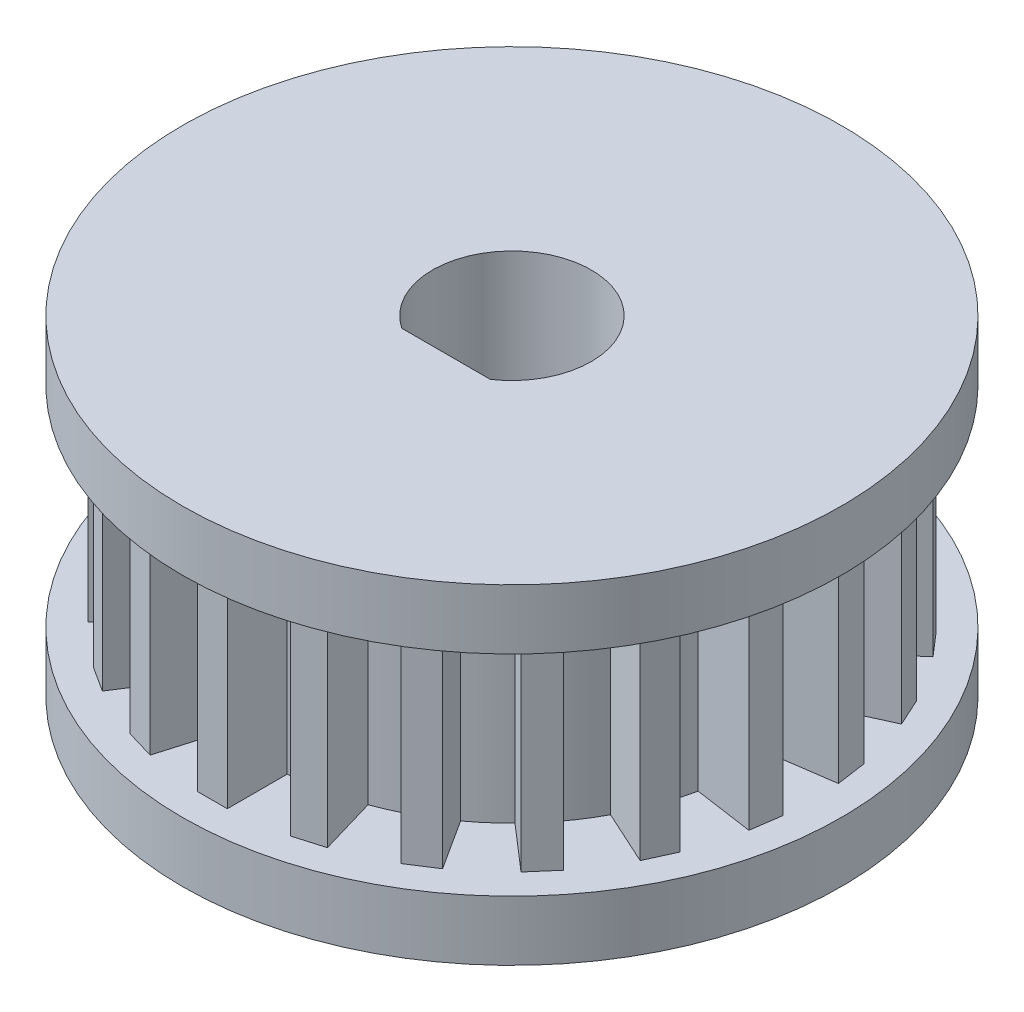
from build123d import *

# Parameters (mm, degrees)
BOSS_EXTRUDE1_DEPTH = 11
BOSS_EXTRUDE2_DEPTH = 2
BOSS_EXTRUDE3_START = 9
BOSS_EXTRUDE3_DEPTH = 2


# Read off the part's stored shape, not the designer's step: Boss-Extrude1
with BuildPart() as part:
    # Boss-Extrude1 outline → Boss-Extrude1 (new body)
    with BuildSketch(Plane(origin=(0, 0, 0), x_dir=(1, 0, 0), z_dir=(0, 1, 0))):
        with BuildLine():
            Line((-0.5, -8), (-0.5, -10))
            Line((-0.5, -10), (0.5, -10))
            Line((0.5, -10), (0.5, -8))
            ThreePointArc((0.5, -8), (1.140740208, -7.934022421), (1.774113968, -7.816810067))
            Line((1.774113968, -7.816810067), (2.337579082, -9.735796015))
            Line((2.337579082, -9.735796015), (3.297072055, -9.454063458))
            Line((3.297072055, -9.454063458), (2.733606942, -7.53507751))
            ThreePointArc((2.733606942, -7.53507751), (3.329804637, -7.29125511), (3.904499773, -7.000348671))
            Line((3.904499773, -7.000348671), (4.985781408, -8.682855737))
            Line((4.985781408, -8.682855737), (5.827034941, -8.14221492))
            Line((5.827034941, -8.14221492), (4.745753306, -6.459707854))
            ThreePointArc((4.745753306, -6.459707854), (5.249108098, -6.057793673), (5.718566228, -5.616760659))
            Line((5.718566228, -5.616760659), (7.230065377, -6.926482127))
            Line((7.230065377, -6.926482127), (7.884926111, -6.170732552))
            Line((7.884926111, -6.170732552), (6.373426962, -4.861011084))
            ThreePointArc((6.373426962, -4.861011084), (6.743160038, -4.333565819), (7.069348456, -3.778136102))
            Line((7.069348456, -3.778136102), (8.888612447, -4.608966128))
            Line((8.888612447, -4.608966128), (9.30402746, -3.699334132))
            Line((9.30402746, -3.699334132), (7.484763469, -2.868504106))
            ThreePointArc((7.484763469, -2.868504106), (7.690921254, -2.258258235), (7.847414116, -1.633429427))
            Line((7.847414116, -1.633429427), (9.827057, -1.918059104))
            Line((9.827057, -1.918059104), (9.969371838, -0.928237662))
            Line((9.969371838, -0.928237662), (7.989728954, -0.643607985))
            ThreePointArc((7.989728954, -0.643607985), (8.015609771, 0), (7.989728954, 0.643607985))
            Line((7.989728954, 0.643607985), (9.969371838, 0.928237662))
            Line((9.969371838, 0.928237662), (9.827057, 1.918059104))
            Line((9.827057, 1.918059104), (7.847414116, 1.633429427))
            ThreePointArc((7.847414116, 1.633429427), (7.690921254, 2.258258235), (7.484763469, 2.868504106))
            Line((7.484763469, 2.868504106), (9.30402746, 3.699334132))
            Line((9.30402746, 3.699334132), (8.888612447, 4.608966128))
            Line((8.888612447, 4.608966128), (7.069348456, 3.778136102))
            ThreePointArc((7.069348456, 3.778136102), (6.743160038, 4.333565819), (6.373426962, 4.861011084))
            Line((6.373426962, 4.861011084), (7.884926111, 6.170732552))
            Line((7.884926111, 6.170732552), (7.230065377, 6.926482127))
            Line((7.230065377, 6.926482127), (5.718566228, 5.616760659))
            ThreePointArc((5.718566228, 5.616760659), (5.249108098, 6.057793673), (4.745753306, 6.459707854))
            Line((4.745753306, 6.459707854), (5.827034941, 8.14221492))
            Line((5.827034941, 8.14221492), (4.985781408, 8.682855737))
            Line((4.985781408, 8.682855737), (3.904499773, 7.000348671))
            ThreePointArc((3.904499773, 7.000348671), (3.329804637, 7.29125511), (2.733606942, 7.53507751))
            Line((2.733606942, 7.53507751), (3.297072055, 9.454063458))
            Line((3.297072055, 9.454063458), (2.337579082, 9.735796015))
            Line((2.337579082, 9.735796015), (1.774113968, 7.816810067))
            ThreePointArc((1.774113968, 7.816810067), (1.140740208, 7.934022421), (0.5, 8))
            Line((0.5, 8), (0.5, 10))
            Line((0.5, 10), (-0.5, 10))
            Line((-0.5, 10), (-0.5, 8))
            ThreePointArc((-0.5, 8), (-1.140740208, 7.934022421), (-1.774113968, 7.816810067))
            Line((-1.774113968, 7.816810067), (-2.337579082, 9.735796015))
            Line((-2.337579082, 9.735796015), (-3.297072055, 9.454063458))
            Line((-3.297072055, 9.454063458), (-2.733606942, 7.53507751))
            ThreePointArc((-2.733606942, 7.53507751), (-3.329804637, 7.29125511), (-3.904499773, 7.000348671))
            Line((-3.904499773, 7.000348671), (-4.985781408, 8.682855737))
            Line((-4.985781408, 8.682855737), (-5.827034941, 8.14221492))
            Line((-5.827034941, 8.14221492), (-4.745753306, 6.459707854))
            ThreePointArc((-4.745753306, 6.459707854), (-5.249108098, 6.057793673), (-5.718566228, 5.616760659))
            Line((-5.718566228, 5.616760659), (-7.230065377, 6.926482127))
            Line((-7.230065377, 6.926482127), (-7.884926111, 6.170732552))
            Line((-7.884926111, 6.170732552), (-6.373426962, 4.861011084))
            ThreePointArc((-6.373426962, 4.861011084), (-6.743160038, 4.333565819), (-7.069348456, 3.778136102))
            Line((-7.069348456, 3.778136102), (-8.888612447, 4.608966128))
            Line((-8.888612447, 4.608966128), (-9.30402746, 3.699334132))
            Line((-9.30402746, 3.699334132), (-7.484763469, 2.868504106))
            ThreePointArc((-7.484763469, 2.868504106), (-7.690921254, 2.258258235), (-7.847414116, 1.633429427))
            Line((-7.847414116, 1.633429427), (-9.827057, 1.918059104))
            Line((-9.827057, 1.918059104), (-9.969371838, 0.928237662))
            Line((-9.969371838, 0.928237662), (-7.989728954, 0.643607985))
            ThreePointArc((-7.989728954, 0.643607985), (-8.015609771, 0), (-7.989728954, -0.643607985))
            Line((-7.989728954, -0.643607985), (-9.969371838, -0.928237662))
            Line((-9.969371838, -0.928237662), (-9.827057, -1.918059104))
            Line((-9.827057, -1.918059104), (-7.847414116, -1.633429427))
            ThreePointArc((-7.847414116, -1.633429427), (-7.690921254, -2.258258235), (-7.484763469, -2.868504106))
            Line((-7.484763469, -2.868504106), (-9.30402746, -3.699334132))
            Line((-9.30402746, -3.699334132), (-8.888612447, -4.608966128))
            Line((-8.888612447, -4.608966128), (-7.069348456, -3.778136102))
            ThreePointArc((-7.069348456, -3.778136102), (-6.743160038, -4.333565819), (-6.373426962, -4.861011084))
            Line((-6.373426962, -4.861011084), (-7.884926111, -6.170732552))
            Line((-7.884926111, -6.170732552), (-7.230065377, -6.926482127))
            Line((-7.230065377, -6.926482127), (-5.718566228, -5.616760659))
            ThreePointArc((-5.718566228, -5.616760659), (-5.249108098, -6.057793673), (-4.745753306, -6.459707854))
            Line((-4.745753306, -6.459707854), (-5.827034941, -8.14221492))
            Line((-5.827034941, -8.14221492), (-4.985781408, -8.682855737))
            Line((-4.985781408, -8.682855737), (-3.904499773, -7.000348671))
            ThreePointArc((-3.904499773, -7.000348671), (-3.329804637, -7.29125511), (-2.733606942, -7.53507751))
            Line((-2.733606942, -7.53507751), (-3.297072055, -9.454063458))
            Line((-3.297072055, -9.454063458), (-2.337579082, -9.735796015))
            Line((-2.337579082, -9.735796015), (-1.774113968, -7.816810067))
            ThreePointArc((-1.774113968, -7.816810067), (-1.140740208, -7.934022421), (-0.5, -8))
        make_face()
        with BuildLine():
            Line((1.47732867, -2.2), (-1.47732867, -2.2))
            ThreePointArc((-1.47732867, -2.2), (0, 2.65), (1.47732867, -2.2))
        make_face(mode=Mode.SUBTRACT)
    extrude(amount=BOSS_EXTRUDE1_DEPTH)

    # Sketch1<6> → Boss-Extrude2 (add)
    with BuildSketch(Plane(origin=(0, 0, 0), x_dir=(1, 0, 0), z_dir=(0, 1, 0))):
        with BuildLine():
            Line((0, 10), (0, 11))
            ThreePointArc((0, 11), (-11, 0), (0, -11))
            Line((0, -11), (0, -10))
            Line((0, -10), (-0.5, -10))
            Line((-0.5, -10), (-0.5, -8))
            ThreePointArc((-0.5, -8), (-1.140740208, -7.934022421), (-1.774113968, -7.816810067))
            Line((-1.774113968, -7.816810067), (-2.337579082, -9.735796015))
            Line((-2.337579082, -9.735796015), (-3.297072055, -9.454063458))
            Line((-3.297072055, -9.454063458), (-2.733606942, -7.53507751))
            ThreePointArc((-2.733606942, -7.53507751), (-3.329804637, -7.29125511), (-3.904499773, -7.000348671))
            Line((-3.904499773, -7.000348671), (-4.985781408, -8.682855737))
            Line((-4.985781408, -8.682855737), (-5.827034941, -8.14221492))
            Line((-5.827034941, -8.14221492), (-4.745753306, -6.459707854))
            ThreePointArc((-4.745753306, -6.459707854), (-5.249108098, -6.057793673), (-5.718566228, -5.616760659))
            Line((-5.718566228, -5.616760659), (-7.230065377, -6.926482127))
            Line((-7.230065377, -6.926482127), (-7.884926111, -6.170732552))
            Line((-7.884926111, -6.170732552), (-6.373426962, -4.861011084))
            ThreePointArc((-6.373426962, -4.861011084), (-6.743160038, -4.333565819), (-7.069348456, -3.778136102))
            Line((-7.069348456, -3.778136102), (-8.888612447, -4.608966128))
            Line((-8.888612447, -4.608966128), (-9.30402746, -3.699334132))
            Line((-9.30402746, -3.699334132), (-7.484763469, -2.868504106))
            ThreePointArc((-7.484763469, -2.868504106), (-7.690921254, -2.258258235), (-7.847414116, -1.633429427))
            Line((-7.847414116, -1.633429427), (-9.827057, -1.918059104))
            Line((-9.827057, -1.918059104), (-9.969371838, -0.928237662))
            Line((-9.969371838, -0.928237662), (-7.989728954, -0.643607985))
            ThreePointArc((-7.989728954, -0.643607985), (-8.015609771, 0), (-7.989728954, 0.643607985))
            Line((-7.989728954, 0.643607985), (-9.969371838, 0.928237662))
            Line((-9.969371838, 0.928237662), (-9.827057, 1.918059104))
            Line((-9.827057, 1.918059104), (-7.847414116, 1.633429427))
            ThreePointArc((-7.847414116, 1.633429427), (-7.690921254, 2.258258235), (-7.484763469, 2.868504106))
            Line((-7.484763469, 2.868504106), (-9.30402746, 3.699334132))
            Line((-9.30402746, 3.699334132), (-8.888612447, 4.608966128))
            Line((-8.888612447, 4.608966128), (-7.069348456, 3.778136102))
            ThreePointArc((-7.069348456, 3.778136102), (-6.743160038, 4.333565819), (-6.373426962, 4.861011084))
            Line((-6.373426962, 4.861011084), (-7.884926111, 6.170732552))
            Line((-7.884926111, 6.170732552), (-7.230065377, 6.926482127))
            Line((-7.230065377, 6.926482127), (-5.718566228, 5.616760659))
            ThreePointArc((-5.718566228, 5.616760659), (-5.249108098, 6.057793673), (-4.745753306, 6.459707854))
            Line((-4.745753306, 6.459707854), (-5.827034941, 8.14221492))
            Line((-5.827034941, 8.14221492), (-4.985781408, 8.682855737))
            Line((-4.985781408, 8.682855737), (-3.904499773, 7.000348671))
            ThreePointArc((-3.904499773, 7.000348671), (-3.329804637, 7.29125511), (-2.733606942, 7.53507751))
            Line((-2.733606942, 7.53507751), (-3.297072055, 9.454063458))
            Line((-3.297072055, 9.454063458), (-2.337579082, 9.735796015))
            Line((-2.337579082, 9.735796015), (-1.774113968, 7.816810067))
            ThreePointArc((-1.774113968, 7.816810067), (-1.140740208, 7.934022421), (-0.5, 8))
            Line((-0.5, 8), (-0.5, 10))
            Line((-0.5, 10), (0, 10))
        make_face()
        with BuildLine():
            ThreePointArc((11, 0), (7.778174593, 7.778174593), (0, 11))
            Line((0, 11), (0, 10))
            Line((0, 10), (0.5, 10))
            Line((0.5, 10), (0.5, 8))
            ThreePointArc((0.5, 8), (1.140740208, 7.934022421), (1.774113968, 7.816810067))
            Line((1.774113968, 7.816810067), (2.337579082, 9.735796015))
            Line((2.337579082, 9.735796015), (3.297072055, 9.454063458))
            Line((3.297072055, 9.454063458), (2.733606942, 7.53507751))
            ThreePointArc((2.733606942, 7.53507751), (3.329804637, 7.29125511), (3.904499773, 7.000348671))
            Line((3.904499773, 7.000348671), (4.985781408, 8.682855737))
            Line((4.985781408, 8.682855737), (5.827034941, 8.14221492))
            Line((5.827034941, 8.14221492), (4.745753306, 6.459707854))
            ThreePointArc((4.745753306, 6.459707854), (5.249108098, 6.057793673), (5.718566228, 5.616760659))
            Line((5.718566228, 5.616760659), (7.230065377, 6.926482127))
            Line((7.230065377, 6.926482127), (7.884926111, 6.170732552))
            Line((7.884926111, 6.170732552), (6.373426962, 4.861011084))
            ThreePointArc((6.373426962, 4.861011084), (6.743160038, 4.333565819), (7.069348456, 3.778136102))
            Line((7.069348456, 3.778136102), (8.888612447, 4.608966128))
            Line((8.888612447, 4.608966128), (9.30402746, 3.699334132))
            Line((9.30402746, 3.699334132), (7.484763469, 2.868504106))
            ThreePointArc((7.484763469, 2.868504106), (7.690921254, 2.258258235), (7.847414116, 1.633429427))
            Line((7.847414116, 1.633429427), (9.827057, 1.918059104))
            Line((9.827057, 1.918059104), (9.969371838, 0.928237662))
            Line((9.969371838, 0.928237662), (7.989728954, 0.643607985))
            ThreePointArc((7.989728954, 0.643607985), (8.009136953, 0.322064068), (8.015609771, 0))
            ThreePointArc((8.015609771, 0), (8.009136953, -0.322064068), (7.989728954, -0.643607985))
            Line((7.989728954, -0.643607985), (9.969371838, -0.928237662))
            Line((9.969371838, -0.928237662), (9.827057, -1.918059104))
            Line((9.827057, -1.918059104), (7.847414116, -1.633429427))
            ThreePointArc((7.847414116, -1.633429427), (7.690921254, -2.258258235), (7.484763469, -2.868504106))
            Line((7.484763469, -2.868504106), (9.30402746, -3.699334132))
            Line((9.30402746, -3.699334132), (8.888612447, -4.608966128))
            Line((8.888612447, -4.608966128), (7.069348456, -3.778136102))
            ThreePointArc((7.069348456, -3.778136102), (6.743160038, -4.333565819), (6.373426962, -4.861011084))
            Line((6.373426962, -4.861011084), (7.884926111, -6.170732552))
            Line((7.884926111, -6.170732552), (7.230065377, -6.926482127))
            Line((7.230065377, -6.926482127), (5.718566228, -5.616760659))
            ThreePointArc((5.718566228, -5.616760659), (5.249108098, -6.057793673), (4.745753306, -6.459707854))
            Line((4.745753306, -6.459707854), (5.827034941, -8.14221492))
            Line((5.827034941, -8.14221492), (4.985781408, -8.682855737))
            Line((4.985781408, -8.682855737), (3.904499773, -7.000348671))
            ThreePointArc((3.904499773, -7.000348671), (3.329804637, -7.29125511), (2.733606942, -7.53507751))
            Line((2.733606942, -7.53507751), (3.297072055, -9.454063458))
            Line((3.297072055, -9.454063458), (2.337579082, -9.735796015))
            Line((2.337579082, -9.735796015), (1.774113968, -7.816810067))
            ThreePointArc((1.774113968, -7.816810067), (1.140740208, -7.934022421), (0.5, -8))
            Line((0.5, -8), (0.5, -10))
            Line((0.5, -10), (0, -10))
            Line((0, -10), (0, -11))
            ThreePointArc((0, -11), (7.778174593, -7.778174593), (11, 0))
        make_face()
    extrude(amount=BOSS_EXTRUDE2_DEPTH)

    # Sketch1<7> → Boss-Extrude3 (add)
    with BuildSketch(Plane(origin=(0, 0, 0), x_dir=(1, 0, 0), z_dir=(0, 1, 0)).offset(BOSS_EXTRUDE3_START)):
        with BuildLine():
            ThreePointArc((11, 0), (7.778174593, 7.778174593), (0, 11))
            Line((0, 11), (0, 10))
            Line((0, 10), (0.5, 10))
            Line((0.5, 10), (0.5, 8))
            ThreePointArc((0.5, 8), (1.140740208, 7.934022421), (1.774113968, 7.816810067))
            Line((1.774113968, 7.816810067), (2.337579082, 9.735796015))
            Line((2.337579082, 9.735796015), (3.297072055, 9.454063458))
            Line((3.297072055, 9.454063458), (2.733606942, 7.53507751))
            ThreePointArc((2.733606942, 7.53507751), (3.329804637, 7.29125511), (3.904499773, 7.000348671))
            Line((3.904499773, 7.000348671), (4.985781408, 8.682855737))
            Line((4.985781408, 8.682855737), (5.827034941, 8.14221492))
            Line((5.827034941, 8.14221492), (4.745753306, 6.459707854))
            ThreePointArc((4.745753306, 6.459707854), (5.249108098, 6.057793673), (5.718566228, 5.616760659))
            Line((5.718566228, 5.616760659), (7.230065377, 6.926482127))
            Line((7.230065377, 6.926482127), (7.884926111, 6.170732552))
            Line((7.884926111, 6.170732552), (6.373426962, 4.861011084))
            ThreePointArc((6.373426962, 4.861011084), (6.743160038, 4.333565819), (7.069348456, 3.778136102))
            Line((7.069348456, 3.778136102), (8.888612447, 4.608966128))
            Line((8.888612447, 4.608966128), (9.30402746, 3.699334132))
            Line((9.30402746, 3.699334132), (7.484763469, 2.868504106))
            ThreePointArc((7.484763469, 2.868504106), (7.690921254, 2.258258235), (7.847414116, 1.633429427))
            Line((7.847414116, 1.633429427), (9.827057, 1.918059104))
            Line((9.827057, 1.918059104), (9.969371838, 0.928237662))
            Line((9.969371838, 0.928237662), (7.989728954, 0.643607985))
            ThreePointArc((7.989728954, 0.643607985), (8.009136953, 0.322064068), (8.015609771, 0))
            ThreePointArc((8.015609771, 0), (8.009136953, -0.322064068), (7.989728954, -0.643607985))
            Line((7.989728954, -0.643607985), (9.969371838, -0.928237662))
            Line((9.969371838, -0.928237662), (9.827057, -1.918059104))
            Line((9.827057, -1.918059104), (7.847414116, -1.633429427))
            ThreePointArc((7.847414116, -1.633429427), (7.690921254, -2.258258235), (7.484763469, -2.868504106))
            Line((7.484763469, -2.868504106), (9.30402746, -3.699334132))
            Line((9.30402746, -3.699334132), (8.888612447, -4.608966128))
            Line((8.888612447, -4.608966128), (7.069348456, -3.778136102))
            ThreePointArc((7.069348456, -3.778136102), (6.743160038, -4.333565819), (6.373426962, -4.861011084))
            Line((6.373426962, -4.861011084), (7.884926111, -6.170732552))
            Line((7.884926111, -6.170732552), (7.230065377, -6.926482127))
            Line((7.230065377, -6.926482127), (5.718566228, -5.616760659))
            ThreePointArc((5.718566228, -5.616760659), (5.249108098, -6.057793673), (4.745753306, -6.459707854))
            Line((4.745753306, -6.459707854), (5.827034941, -8.14221492))
            Line((5.827034941, -8.14221492), (4.985781408, -8.682855737))
            Line((4.985781408, -8.682855737), (3.904499773, -7.000348671))
            ThreePointArc((3.904499773, -7.000348671), (3.329804637, -7.29125511), (2.733606942, -7.53507751))
            Line((2.733606942, -7.53507751), (3.297072055, -9.454063458))
            Line((3.297072055, -9.454063458), (2.337579082, -9.735796015))
            Line((2.337579082, -9.735796015), (1.774113968, -7.816810067))
            ThreePointArc((1.774113968, -7.816810067), (1.140740208, -7.934022421), (0.5, -8))
            Line((0.5, -8), (0.5, -10))
            Line((0.5, -10), (0, -10))
            Line((0, -10), (0, -11))
            ThreePointArc((0, -11), (7.778174593, -7.778174593), (11, 0))
        make_face()
        with BuildLine():
            Line((0, 10), (0, 11))
            ThreePointArc((0, 11), (-11, 0), (0, -11))
            Line((0, -11), (0, -10))
            Line((0, -10), (-0.5, -10))
            Line((-0.5, -10), (-0.5, -8))
            ThreePointArc((-0.5, -8), (-1.140740208, -7.934022421), (-1.774113968, -7.816810067))
            Line((-1.774113968, -7.816810067), (-2.337579082, -9.735796015))
            Line((-2.337579082, -9.735796015), (-3.297072055, -9.454063458))
            Line((-3.297072055, -9.454063458), (-2.733606942, -7.53507751))
            ThreePointArc((-2.733606942, -7.53507751), (-3.329804637, -7.29125511), (-3.904499773, -7.000348671))
            Line((-3.904499773, -7.000348671), (-4.985781408, -8.682855737))
            Line((-4.985781408, -8.682855737), (-5.827034941, -8.14221492))
            Line((-5.827034941, -8.14221492), (-4.745753306, -6.459707854))
            ThreePointArc((-4.745753306, -6.459707854), (-5.249108098, -6.057793673), (-5.718566228, -5.616760659))
            Line((-5.718566228, -5.616760659), (-7.230065377, -6.926482127))
            Line((-7.230065377, -6.926482127), (-7.884926111, -6.170732552))
            Line((-7.884926111, -6.170732552), (-6.373426962, -4.861011084))
            ThreePointArc((-6.373426962, -4.861011084), (-6.743160038, -4.333565819), (-7.069348456, -3.778136102))
            Line((-7.069348456, -3.778136102), (-8.888612447, -4.608966128))
            Line((-8.888612447, -4.608966128), (-9.30402746, -3.699334132))
            Line((-9.30402746, -3.699334132), (-7.484763469, -2.868504106))
            ThreePointArc((-7.484763469, -2.868504106), (-7.690921254, -2.258258235), (-7.847414116, -1.633429427))
            Line((-7.847414116, -1.633429427), (-9.827057, -1.918059104))
            Line((-9.827057, -1.918059104), (-9.969371838, -0.928237662))
            Line((-9.969371838, -0.928237662), (-7.989728954, -0.643607985))
            ThreePointArc((-7.989728954, -0.643607985), (-8.015609771, 0), (-7.989728954, 0.643607985))
            Line((-7.989728954, 0.643607985), (-9.969371838, 0.928237662))
            Line((-9.969371838, 0.928237662), (-9.827057, 1.918059104))
            Line((-9.827057, 1.918059104), (-7.847414116, 1.633429427))
            ThreePointArc((-7.847414116, 1.633429427), (-7.690921254, 2.258258235), (-7.484763469, 2.868504106))
            Line((-7.484763469, 2.868504106), (-9.30402746, 3.699334132))
            Line((-9.30402746, 3.699334132), (-8.888612447, 4.608966128))
            Line((-8.888612447, 4.608966128), (-7.069348456, 3.778136102))
            ThreePointArc((-7.069348456, 3.778136102), (-6.743160038, 4.333565819), (-6.373426962, 4.861011084))
            Line((-6.373426962, 4.861011084), (-7.884926111, 6.170732552))
            Line((-7.884926111, 6.170732552), (-7.230065377, 6.926482127))
            Line((-7.230065377, 6.926482127), (-5.718566228, 5.616760659))
            ThreePointArc((-5.718566228, 5.616760659), (-5.249108098, 6.057793673), (-4.745753306, 6.459707854))
            Line((-4.745753306, 6.459707854), (-5.827034941, 8.14221492))
            Line((-5.827034941, 8.14221492), (-4.985781408, 8.682855737))
            Line((-4.985781408, 8.682855737), (-3.904499773, 7.000348671))
            ThreePointArc((-3.904499773, 7.000348671), (-3.329804637, 7.29125511), (-2.733606942, 7.53507751))
            Line((-2.733606942, 7.53507751), (-3.297072055, 9.454063458))
            Line((-3.297072055, 9.454063458), (-2.337579082, 9.735796015))
            Line((-2.337579082, 9.735796015), (-1.774113968, 7.816810067))
            ThreePointArc((-1.774113968, 7.816810067), (-1.140740208, 7.934022421), (-0.5, 8))
            Line((-0.5, 8), (-0.5, 10))
            Line((-0.5, 10), (0, 10))
        make_face()
    extrude(amount=BOSS_EXTRUDE3_DEPTH)


solid = part.part
